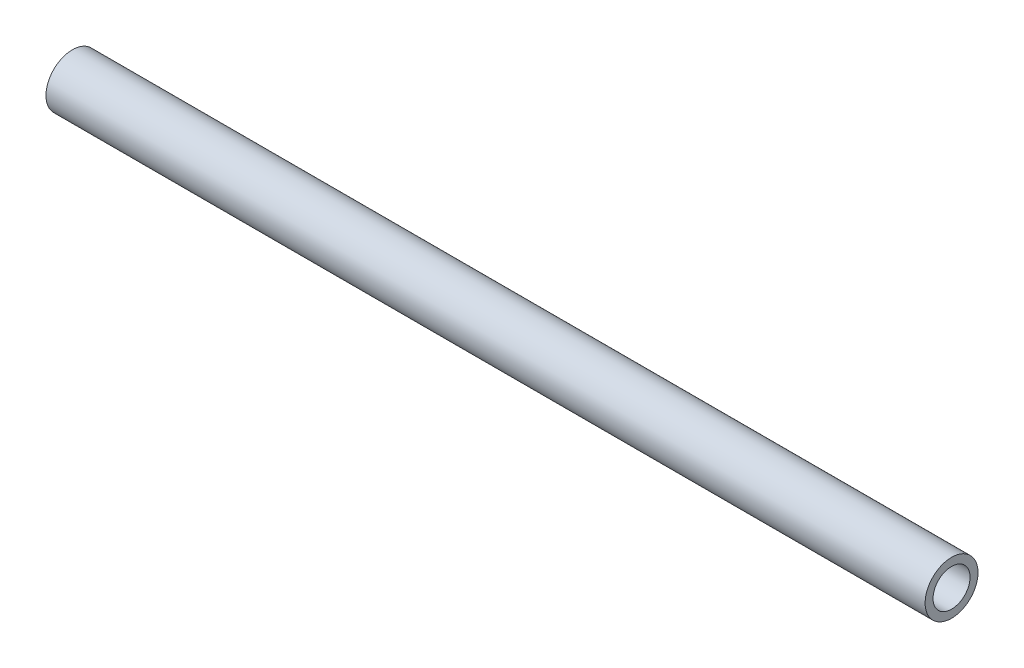
from build123d import *

# Parameters (mm, degrees)
SKETCH1_W = 332.42703798
SKETCH1_H = 3


with BuildPart() as part:
    # Sketch1 → Revolve1 (revolve)
    with BuildSketch(Plane.XY):
        with Locations((0, 8.5)):
            Rectangle(SKETCH1_W, SKETCH1_H)
    revolve(axis=Axis((265.225, 0, 0), (-1, 0, 0)))


solid = part.part
